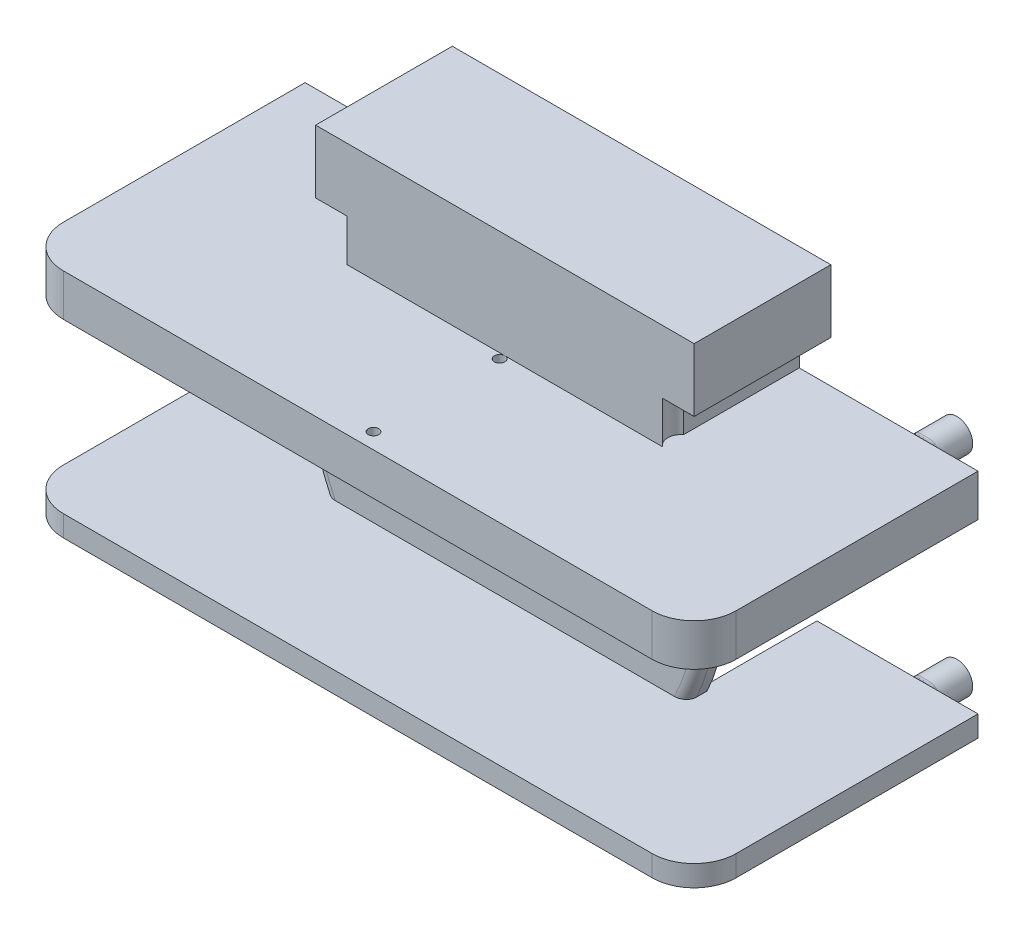
from build123d import *

# Parameters (mm, degrees)
BOSS_EXTRUDE1_DEPTH     = 1
SKETCH2_R               = 1.5375
BOSS_EXTRUDE2_DEPTH     = 4
SKETCH3_R               = 2
BOSS_EXTRUDE3_DEPTH     = 0.5
SKETCH4_W               = 2
SKETCH4_H               = 17
BOSS_EXTRUDE4_DEPTH     = 5.5
SKETCH5_W               = 18
SKETCH5_H               = 2
BOSS_EXTRUDE5_DEPTH     = 5.5
SKETCH6_W               = 6.5
SKETCH6_H               = 2
BOSS_EXTRUDE6_DEPTH     = 5
BOSS_EXTRUDE7_DEPTH     = 5.5
CUT_EXTRUDE1_DEPTH      = 21.475595229
SKETCH9_W               = 2.937742252
SKETCH9_H               = 8
CUT_EXTRUDE2_DEPTH      = 5.5
CUT_EXTRUDE11_START     = -5.5
SKETCH21_R              = 9.25
SKETCH21_R_2            = 2
CUT_EXTRUDE11_DEPTH     = 5.5
SKETCH10_W              = 32
SKETCH10_H              = 2
BOSS_EXTRUDE8_DEPTH     = 7
FILLET1_R               = 0.5
SKETCH11_R              = 0.75
BOSS_EXTRUDE9_DEPTH     = 2
SKETCH14_W              = 3.5
SKETCH14_H              = 2
CUT_EXTRUDE5_DEPTH      = 24.648467306
SKETCH12_R              = 0.8
CUT_EXTRUDE3_DEPTH      = 2.5
CUT_EXTRUDE6_DEPTH      = 2
FILLET2_R               = 0.5
FILLET3_R               = 0.5
FILLET4_R               = 2
CUT_EXTRUDE7_DEPTH      = 25.677925456
CUT_EXTRUDE7_DEPTH_BACK = 1
SKETCH19_R              = 0.25
CUT_EXTRUDE9_DEPTH      = 2
SKETCH20_W              = 2
SKETCH20_H              = 3
CUT_EXTRUDE10_DEPTH     = 24.648467306


with BuildPart() as part:
    # Sketch1 → Boss-Extrude1 (new body)
    with BuildSketch(Plane.XY):
        Polygon((-11, 6), (-11, 11), (11, 11), (11, 6), (11, -6), (-11, -6), align=None)
    extrude(amount=BOSS_EXTRUDE1_DEPTH)

    # Sketch2 → Boss-Extrude2 (add)
    with BuildSketch(Plane(origin=(0, 0, 0), x_dir=(-1, 0, 0), z_dir=(0, 0, -1))):
        with Locations(Location((0, 0, 0), (0, 0, 180))):
            Circle(SKETCH2_R)
    extrude(amount=BOSS_EXTRUDE2_DEPTH)

    # Sketch3 → Boss-Extrude3 (add)
    with BuildSketch(Plane(origin=(0, 0, 0), x_dir=(-1, 0, 0), z_dir=(0, 0, -1))):
        with Locations(Location((0, 0, 0), (0, 0, 180))):
            Circle(SKETCH3_R)
    extrude(amount=BOSS_EXTRUDE3_DEPTH)

    # Sketch4 → Boss-Extrude4 (add)
    with BuildSketch(Plane(origin=(0, 0, 0), x_dir=(-1, 0, 0), z_dir=(0, 0, -1))):
        with Locations((10, 2.5)):
            Rectangle(SKETCH4_W, SKETCH4_H)
        with Locations((-10, 2.5)):
            Rectangle(SKETCH4_W, SKETCH4_H)
    extrude(amount=BOSS_EXTRUDE4_DEPTH)

    # Sketch5 → Boss-Extrude5 (add)
    with BuildSketch(Plane(origin=(0, 0, 0), x_dir=(-1, 0, 0), z_dir=(0, 0, -1))):
        with Locations((0, 10)):
            Rectangle(SKETCH5_W, SKETCH5_H)
    extrude(amount=BOSS_EXTRUDE5_DEPTH)

    # Sketch6 → Boss-Extrude6 (add)
    with BuildSketch(Plane(origin=(11, 0, 0), x_dir=(0, 0, -1), z_dir=(1, 0, 0))):
        with Locations((2.25, -5)):
            Rectangle(SKETCH6_W, SKETCH6_H)
        with Locations((2.25, 5)):
            Rectangle(SKETCH6_W, SKETCH6_H)
    boss_extrude6 = extrude(amount=BOSS_EXTRUDE6_DEPTH)

    # Mirror1: Boss-Extrude6 across plane
    add(boss_extrude6.mirror(Plane(origin=(0, 0, 0), x_dir=(0, 0, 1), z_dir=(1, 0, 0))))

    # Sketch7 → Boss-Extrude7 (add)
    with BuildSketch(Plane(origin=(0, 0, -5.5), x_dir=(-1, 0, 0), z_dir=(0, 0, -1))):
        with BuildLine():
            ThreePointArc((-6.708203932, -6), (-8.407551231, -3.211398808), (-9, 0))
            Line((-9, 0), (-9, -6))
            Line((-9, -6), (-6.708203932, -6))
        make_face()
        with BuildLine():
            Line((-9, 9), (-9, 0))
            ThreePointArc((-9, 0), (-6.363961031, 6.363961031), (0, 9))
            Line((0, 9), (-9, 9))
        make_face()
    boss_extrude7 = extrude(amount=-BOSS_EXTRUDE7_DEPTH)

    # Sketch8 → Cut-Extrude1 (cut, through all)
    with BuildSketch(Plane(origin=(0, 0, -5.5), x_dir=(-1, 0, 0), z_dir=(0, 0, -1))):
        with BuildLine():
            Line((-11, 4), (-8.61684397, 4))
            ThreePointArc((-8.61684397, 4), (-9.5, 0), (-8.61684397, -4))
            Line((-8.61684397, -4), (-11, -4))
            Line((-11, -4), (-11, 4))
        make_face()
    cut_extrude1 = extrude(amount=-CUT_EXTRUDE1_DEPTH, mode=Mode.SUBTRACT)

    # Sketch9 → Cut-Extrude2 (cut)
    with BuildSketch(Plane(origin=(0, 0, -5.5), x_dir=(-1, 0, 0), z_dir=(0, 0, -1))):
        with Locations((-9.531128874, 0)):
            Rectangle(SKETCH9_W, SKETCH9_H)
    cut_extrude2 = extrude(amount=-CUT_EXTRUDE2_DEPTH, mode=Mode.SUBTRACT)

    # Mirror2: Boss-Extrude7, Cut-Extrude1, Cut-Extrude2 across plane
    add(boss_extrude7.mirror(Plane(origin=(0, 0, 0), x_dir=(0, 0, 1), z_dir=(1, 0, 0))))
    add(cut_extrude1.mirror(Plane(origin=(0, 0, 0), x_dir=(0, 0, 1), z_dir=(1, 0, 0))), mode=Mode.SUBTRACT)
    add(cut_extrude2.mirror(Plane(origin=(0, 0, 0), x_dir=(0, 0, 1), z_dir=(1, 0, 0))), mode=Mode.SUBTRACT)

    # Sketch21 → Cut-Extrude11 (cut)
    with BuildSketch(Plane(origin=(0, 0, -5.5), x_dir=(-1, 0, 0), z_dir=(0, 0, -1)).offset(CUT_EXTRUDE11_START)):
        Circle(SKETCH21_R)
        with Locations(Location((0, 0, 0), (0, 0, 180))):
            Circle(SKETCH21_R_2, mode=Mode.SUBTRACT)
    extrude(amount=CUT_EXTRUDE11_DEPTH, mode=Mode.SUBTRACT)

    # Sketch10 → Boss-Extrude8 (add)
    with BuildSketch(Plane.XY.offset(1)):
        with Locations((0, -5)):
            Rectangle(SKETCH10_W, SKETCH10_H)
        with Locations((0, 5)):
            Rectangle(SKETCH10_W, SKETCH10_H)
    extrude(amount=BOSS_EXTRUDE8_DEPTH)

    # Fillet1
    fillet1_edges = [part.edges().sort_by_distance(p)[0] for p in [
        (9.5, 0, 1),
        (-9.5, 0, 1),
    ]]
    fillet(fillet1_edges, radius=FILLET1_R)

    # Sketch11 → Boss-Extrude9 (add)
    with BuildSketch(Plane(origin=(0, 0, -5.5), x_dir=(-1, 0, 0), z_dir=(0, 0, -1))):
        with Locations(Location((-13, -5, 0), (0, 0, 180))):
            Circle(SKETCH11_R)
    boss_extrude9 = extrude(amount=BOSS_EXTRUDE9_DEPTH)

    # Sketch14 → Cut-Extrude5 (cut, through all)
    with BuildSketch(Plane(origin=(0, 0, -5.5), x_dir=(-1, 0, 0), z_dir=(0, 0, -1))):
        with Locations((9.25, 7)):
            Rectangle(SKETCH14_W, SKETCH14_H)
        with Locations((-9.25, 7)):
            Rectangle(SKETCH14_W, SKETCH14_H)
    extrude(amount=-CUT_EXTRUDE5_DEPTH, mode=Mode.SUBTRACT)

    # Sketch12 → Cut-Extrude3 (cut)
    with BuildSketch(Plane(origin=(0, 0, -5.5), x_dir=(-1, 0, 0), z_dir=(0, 0, -1))):
        with Locations((13, -5)):
            Circle(SKETCH12_R)
    cut_extrude3 = extrude(amount=-CUT_EXTRUDE3_DEPTH, mode=Mode.SUBTRACT)

    # Sketch16 → Cut-Extrude6 (cut)
    with BuildSketch(Plane(origin=(0, 6, 0), x_dir=(1, 0, 0), z_dir=(0, 1, 0))):
        with BuildLine():
            Line((-7.5, 0), (-7.5, -1))
            ThreePointArc((-7.5, -1), (-7.25, -0.5), (-7.5, 0))
        make_face()
    cut_extrude6 = extrude(amount=CUT_EXTRUDE6_DEPTH, mode=Mode.SUBTRACT)

    # Mirror3: Boss-Extrude9, Cut-Extrude3 across plane
    add(boss_extrude9.mirror(Plane.ZX))
    add(cut_extrude3.mirror(Plane.ZX), mode=Mode.SUBTRACT)

    # Mirror4: Cut-Extrude6 across plane
    add(cut_extrude6.mirror(Plane(origin=(0, 0, 0), x_dir=(0, 0, 1), z_dir=(1, 0, 0))), mode=Mode.SUBTRACT)

    # Fillet2
    fillet2_edges = [part.edges().sort_by_distance(p)[0] for p in [
        (12.25, -5, -5.5),
        (12.25, 5, -5.5),
    ]]
    fillet(fillet2_edges, radius=FILLET2_R)

    # Fillet3
    # the kernel refuses this fillet: 0.5 mm, written as the material it takes off along each edge
    with BuildSketch(Plane(origin=(-13, -5, -5.5), x_dir=(-1, 0, 0), z_dir=(0, -1, 0))) as fillet3_piece_1:
        with BuildLine():
            CenterArc((0.8 + FILLET3_R, -FILLET3_R), FILLET3_R, 90, 90)
            Line((0.8, -FILLET3_R), (0.8, 0))
            Line((0.8, 0), (0.8 + FILLET3_R, 0))
        make_face()
    revolve(axis=Axis((-13, -5, -5.5), (0, 0, -1)), mode=Mode.SUBTRACT)
    with BuildSketch(Plane(origin=(-13, 5, -5.5), x_dir=(-1, 0, 0), z_dir=(0, 1, 0))) as fillet3_piece_2:
        with BuildLine():
            CenterArc((0.8 + FILLET3_R, FILLET3_R), FILLET3_R, 180, 90)
            Line((0.8, FILLET3_R), (0.8, 0))
            Line((0.8, 0), (0.8 + FILLET3_R, 0))
        make_face()
    revolve(axis=Axis((-13, 5, -5.5), (0, 0, 1)), mode=Mode.SUBTRACT)

    # Fillet4
    fillet4_edges = [part.edges().sort_by_distance(p)[0] for p in [
        (16, -5, 8),
        (-16, -5, 8),
        (-16, 5, 8),
        (16, 5, 8),
    ]]
    fillet(fillet4_edges, radius=FILLET4_R)

    # Sketch17 → Cut-Extrude7 (cut, two sides: drawn at the far end of the back side and taken through both)
    with BuildSketch(Plane.XZ.offset(6).offset(-CUT_EXTRUDE7_DEPTH_BACK)):
        with BuildLine():
            Line((-16, 6), (-16, -5.5))
            Line((-16, -5.5), (-14.5, -5.5))
            Line((-14.5, -5.5), (-14.5, 6))
            ThreePointArc((-14.5, 6), (-14.353553391, 6.353553391), (-14, 6.5))
            Line((-14, 6.5), (14, 6.5))
            ThreePointArc((14, 6.5), (14.353553391, 6.353553391), (14.5, 6))
            Line((14.5, 6), (14.5, -5.5))
            Line((14.5, -5.5), (16, -5.5))
            Line((16, -5.5), (16, 6))
            ThreePointArc((16, 6), (15.414213562, 7.414213562), (14, 8))
            Line((14, 8), (-14, 8))
            ThreePointArc((-14, 8), (-15.414213562, 7.414213562), (-16, 6))
        make_face()
    extrude(amount=CUT_EXTRUDE7_DEPTH + CUT_EXTRUDE7_DEPTH_BACK, mode=Mode.SUBTRACT)

    # Sketch19 → Cut-Extrude9 (cut)
    with BuildSketch(Plane(origin=(0, 6, 0), x_dir=(1, 0, 0), z_dir=(0, 1, 0))):
        with Locations(Location((0, -1.25, 0), (0, 0, 90))):
            Circle(SKETCH19_R)
        with Locations(Location((0, -7.25, 0), (0, 0, 270))):
            Circle(SKETCH19_R)
    extrude(amount=-CUT_EXTRUDE9_DEPTH, mode=Mode.SUBTRACT)

    # Sketch20 → Cut-Extrude10 (cut, through all)
    with BuildSketch(Plane(origin=(0, 0, -5.5), x_dir=(-1, 0, 0), z_dir=(0, 0, -1))):
        with Locations((-10, 9.5)):
            Rectangle(SKETCH20_W, SKETCH20_H)
        with Locations((10, 9.5)):
            Rectangle(SKETCH20_W, SKETCH20_H)
    extrude(amount=-CUT_EXTRUDE10_DEPTH, mode=Mode.SUBTRACT)


solid = part.part
